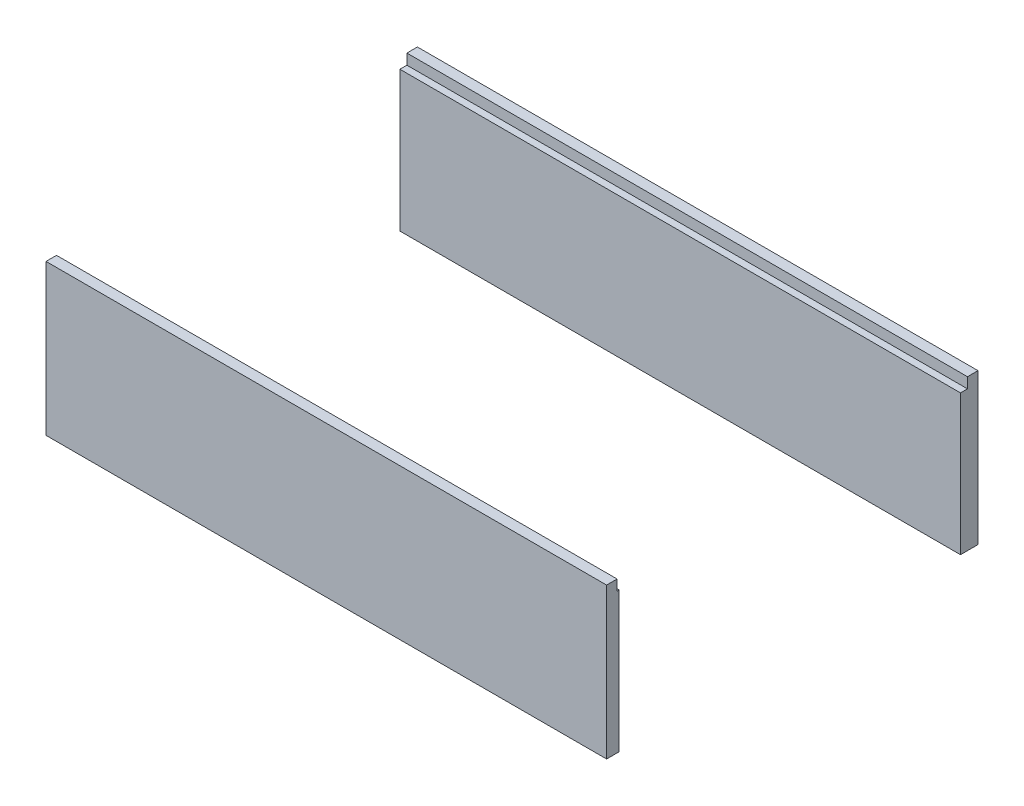
from build123d import *

# Parameters (mm, degrees)
SKETCH3_W             = 80
SKETCH3_H             = 2.5
BOSS_EXTRUDE1_DEPTH   = 21.5
SKETCH3_H_2           = 1.8
BOSS_EXTRUDE1_2_DEPTH = 21.5
SKETCH4_W             = 80
SKETCH4_H             = 0.3
CUT_EXTRUDE1_DEPTH    = 1.5
SKETCH5_W             = 80
SKETCH5_H             = 1
CUT_EXTRUDE2_DEPTH    = 1.5


with BuildPart() as part:
    # Sketch3 → Boss-Extrude1 (new body)
    with BuildSketch(Plane(origin=(0, 0, 0), x_dir=(1, 0, 0), z_dir=(0, 1, 0))):
        with Locations((0.188679245, 1.485849057)):
            Rectangle(SKETCH3_W, SKETCH3_H)
    extrude(amount=BOSS_EXTRUDE1_DEPTH)

    # Sketch5 → Cut-Extrude2 (cut)
    with BuildSketch(Plane(origin=(0, 21.5, 0), x_dir=(1, 0, 0), z_dir=(0, 1, 0))):
        with Locations((0.188679245, 0.735849057)):
            Rectangle(SKETCH5_W, SKETCH5_H)
    extrude(amount=-CUT_EXTRUDE2_DEPTH, mode=Mode.SUBTRACT)


with BuildPart() as body_2:
    # Sketch3 → Boss-Extrude1 2 (new body)
    with BuildSketch(Plane(origin=(0, 0, 0), x_dir=(1, 0, 0), z_dir=(0, 1, 0))):
        with Locations((0.188679245, -49.364150943)):
            Rectangle(SKETCH3_W, SKETCH3_H_2)
    extrude(amount=BOSS_EXTRUDE1_2_DEPTH)

    # Sketch4 → Cut-Extrude1 (cut)
    with BuildSketch(Plane(origin=(0, 21.5, 0), x_dir=(1, 0, 0), z_dir=(0, 1, 0))):
        with Locations((0.188679245, -48.614150943)):
            Rectangle(SKETCH4_W, SKETCH4_H)
    extrude(amount=-CUT_EXTRUDE1_DEPTH, mode=Mode.SUBTRACT)


solid = Compound([part.part, body_2.part])
